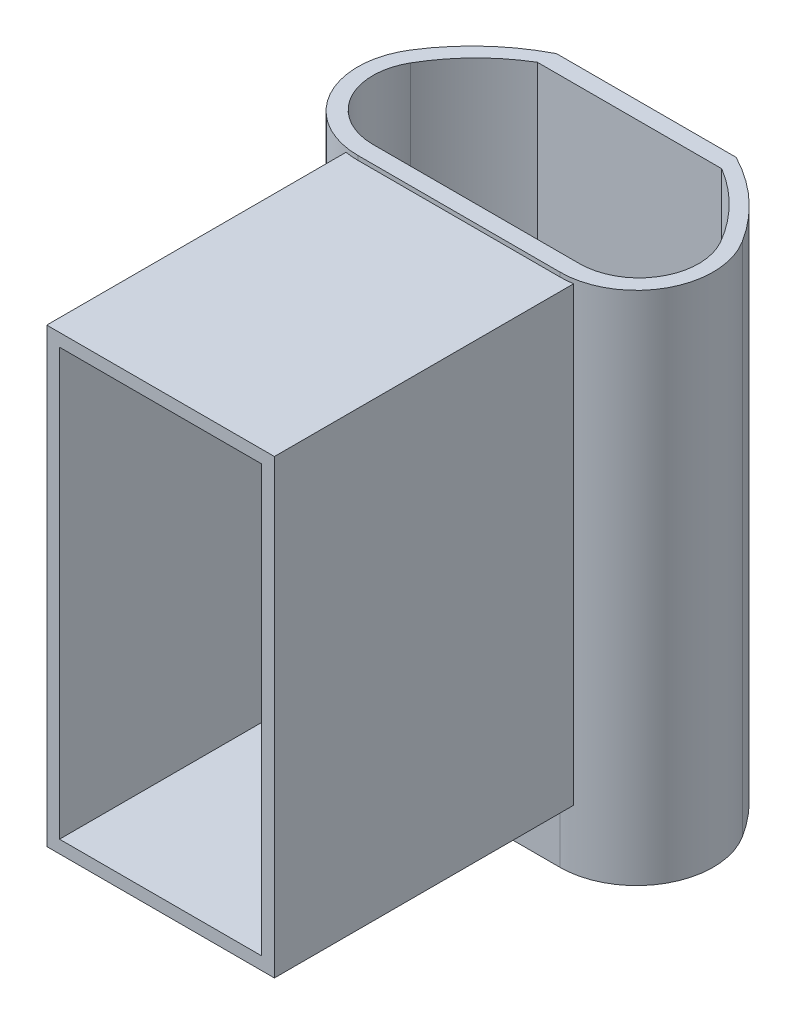
from build123d import *
from build123d.topology import SkipClean

# Parameters (mm, degrees)
CUT_EXTRUDE1_DEPTH           = 5
CUT_EXTRUDE3_DEPTH           = 70
SKETCH8_R                    = 43
CUT_EXTRUDE4_DEPTH           = 65
FILLET1_R                    = 7
SKETCH12_W                   = 6.5
SKETCH12_H                   = 63.5
CUT_REVOLVE1_ANGLE           = 60
CUT_REVOLVE1_OTHER_WAY_ANGLE = 60
SKETCH18_W                   = 13
SKETCH18_H                   = 8
CUT_EXTRUDE13_DEPTH          = 5
SKETCH20_W                   = 100
SKETCH20_H                   = 7
CUT_EXTRUDE15_DEPTH          = 5
SKETCH19_R                   = 1.5
CUT_EXTRUDE14_DEPTH          = 12
FILLET3_R                    = 4
SKETCH24_W                   = 2
SKETCH24_H                   = 3
BOSS_EXTRUDE3_DEPTH          = 2
CIRPATTERN2_COUNT            = 5
SKETCH26_W                   = 5
SKETCH26_H                   = 63.5
CUT_REVOLVE2_ANGLE           = 50
CUT_REVOLVE2_OTHER_WAY_ANGLE = 50
FILLET8_R                    = 9
SKETCH50_W                   = 13
SKETCH50_H                   = 5
CUT_EXTRUDE23_DEPTH          = 7
WRAP1_SECTION_W              = 14
WRAP1_SECTION_H              = 8
WRAP1_ANGLE                  = 29.893450181
SKETCH52_W                   = 21.079035893
SKETCH52_H                   = 8
BOSS_EXTRUDE11_DEPTH         = 7
BOSS_EXTRUDE12_START         = -1
SKETCH53_W                   = 3
SKETCH53_H                   = 7
BOSS_EXTRUDE12_DEPTH         = 3
SKETCH54_W                   = 1.6
SKETCH54_H                   = 7
BOSS_EXTRUDE13_DEPTH         = 16
SKETCH55_W                   = 4
SKETCH55_H                   = 7
BOSS_EXTRUDE14_DEPTH         = 6
SKETCH56_W                   = 3
SKETCH56_H                   = 7
CUT_EXTRUDE24_DEPTH          = 1
FILLET9_R                    = 2
SKETCH57_R                   = 1
CUT_EXTRUDE25_DEPTH          = 2
MIRROR6_START                = 14.3
MIRROR6_DEPTH                = 3.544129525
MIRROR6_START_2              = 19.844129625
MIRROR6_2_DEPTH              = 1.455870375
MIRROR6_START_3              = 17.844129525
MIRROR6_3_DEPTH              = 2.0000001
MIRROR6_START_4              = -10.618295229
MIRROR6_4_OUTLINE_R          = 1
MIRROR6_4_DEPTH              = 2
SKETCH61_W                   = 1.5
SKETCH61_H                   = 40.3
BOSS_EXTRUDE15_DEPTH         = 10
SKETCH63_W                   = 6.5
SKETCH63_H                   = 40.3
CUT_EXTRUDE27_DEPTH          = 10
CUT_EXTRUDE28_DEPTH          = 44
SKETCH67_W                   = 15
SKETCH67_H                   = 8
CUT_EXTRUDE29_DEPTH          = 5
SKETCH68_W                   = 23.715050839
SKETCH68_H                   = 50
CUT_EXTRUDE30_DEPTH          = 8
BOSS_EXTRUDE19_DEPTH         = 35
BOSS_EXTRUDE19_DEPTH_BACK    = 1
SKETCH69_W                   = 26.715050839
SKETCH69_H                   = 53
SKETCH69_W_2                 = 23.715050839
SKETCH69_H_2                 = 50
INTERSECT1_START             = 76
INTERSECT1_OUTLINE_R         = 45
INTERSECT1_OUTLINE_W         = 13
INTERSECT1_OUTLINE_H         = 8
INTERSECT1_DEPTH             = 10.5
INTERSECT1_2_OUTLINE_R       = 45
INTERSECT1_2_OUTLINE_W       = 13
INTERSECT1_2_OUTLINE_H       = 5
INTERSECT1_2_OUTLINE_W_2     = 15
INTERSECT1_2_OUTLINE_H_2     = 8
INTERSECT1_2_DEPTH           = 15.5
INTERSECT1_START_2           = 15.5
INTERSECT1_3_DEPTH           = 60.5
SKETCH70_W                   = 21.079035893
SKETCH70_H                   = 7
CUT_EXTRUDE31_DEPTH          = 10


with BuildPart() as part:
    # Sketch1 → Revolve1 (revolve)
    with BuildSketch(Plane.XY, mode=Mode.PRIVATE) as revolve1_sk:
        with BuildLine():
            Line((0, 86.5), (0, 11.5))
            Line((0, 11.5), (22.7, 11.5))
            Line((22.7, 11.5), (22.7, 0))
            Line((22.7, 0), (25, 0))
            Line((25, 0), (25, 11.5))
            Line((25, 11.5), (45, 11.5))
            Line((45, 11.5), (45, 81.5))
            ThreePointArc((45, 81.5), (43.535533906, 85.035533906), (40, 86.5))
            Line((40, 86.5), (0, 86.5))
        make_face()
    revolve(revolve1_sk.sketch.rotate(Axis((0, 2, 0), (0, 1, 0)), 90), axis=Axis((0, 2, 0), (0, 1, 0)))

    # Sketch5 → Cut-Extrude1 (cut)
    with BuildSketch(Plane(origin=(0, 86.5, 0), x_dir=(1, 0, 0), z_dir=(0, 1, 0))):
        with BuildLine():
            Line((-45, 0), (45, 0))
            ThreePointArc((45, 0), (0, 45), (-45, 0))
        make_face()
    extrude(amount=-CUT_EXTRUDE1_DEPTH, mode=Mode.SUBTRACT)

    # Sketch7 → Cut-Extrude3 (cut)
    with BuildSketch(Plane.XZ.offset(-11.5)):
        with BuildLine():
            Line((21, 0), (-21, 0))
            ThreePointArc((-21, 0), (-18.277714988, -10.340461055), (-10.816653826, -18))
            Line((-10.816653826, -18), (10.816653826, -18))
            ThreePointArc((10.816653826, -18), (18.277714988, -10.340461055), (21, 0))
        make_face()
    extrude(amount=-CUT_EXTRUDE3_DEPTH, mode=Mode.SUBTRACT)

    # Sketch8 → Cut-Extrude4 (cut)
    with BuildSketch(Plane(origin=(0, 79, 0), x_dir=(1, 0, 0), z_dir=(0, 1, 0))):
        with Locations(Location((0, 0, 0), (0, 0, 270))):
            Circle(SKETCH8_R)
        with BuildLine():
            Line((22.912878475, -2), (-22.981606036, -2))
            ThreePointArc((-22.981606036, -2), (-20.067855169, 10.855581536), (-10.573881727, 20))
            Line((-10.573881727, 20), (10.505154166, 20))
            ThreePointArc((10.505154166, 20), (19.999127608, 10.855581536), (22.912878475, -2))
        make_face(mode=Mode.SUBTRACT)
    extrude(amount=-CUT_EXTRUDE4_DEPTH, mode=Mode.SUBTRACT)

    # Fillet1
    fillet1_edges = [part.edges().sort_by_distance(p)[0] for p in [
        (-21, 46.5, 0),
        (21, 46.5, 0),
    ]]
    fillet(fillet1_edges, radius=FILLET1_R)

    # Sketch12 → Cut-Revolve1 (revolve, cut)
    with BuildSketch(Plane(origin=(0, 0, 0), x_dir=(0, 0, -1), z_dir=(1, 0, 0))):
        with Locations((-44.75, 47.25)):
            Rectangle(SKETCH12_W, SKETCH12_H)
    revolve(axis=Axis((0, 81.5, 0), (0, -1, 0)), revolution_arc=CUT_REVOLVE1_ANGLE, mode=Mode.SUBTRACT)

    # Sketch12 → Cut-Revolve1 other way (revolve, cut)
    with BuildSketch(Plane(origin=(0, 0, 0), x_dir=(0, 0, -1), z_dir=(1, 0, 0))):
        with Locations((-44.75, 47.25)):
            Rectangle(SKETCH12_W, SKETCH12_H)
    revolve(axis=Axis((0, 81.5, 0), (0, 1, 0)), revolution_arc=CUT_REVOLVE1_OTHER_WAY_ANGLE, mode=Mode.SUBTRACT)

    # Sketch18 → Cut-Extrude13 (cut)
    with BuildSketch(Plane(origin=(0, 81.5, 0), x_dir=(1, 0, 0), z_dir=(0, 1, 0))):
        with Locations((0, 30)):
            Rectangle(SKETCH18_W, SKETCH18_H)
    extrude(amount=-CUT_EXTRUDE13_DEPTH, mode=Mode.SUBTRACT)

    # Sketch20 → Cut-Extrude15 (cut)
    with BuildSketch(Plane(origin=(0, 86.5, 0), x_dir=(1, 0, 0), z_dir=(0, 1, 0))):
        with Locations((0, -3.5)):
            Rectangle(SKETCH20_W, SKETCH20_H)
    extrude(amount=-CUT_EXTRUDE15_DEPTH, mode=Mode.SUBTRACT)

    # Sketch19 → Cut-Extrude14 (cut)
    with BuildSketch(Plane(origin=(0, 0, 7), x_dir=(-1, 0, 0), z_dir=(0, 0, -1))):
        with Locations((0, 84)):
            Circle(SKETCH19_R)
        with Locations((-30, 84)):
            Circle(SKETCH19_R)
        with Locations((29.452221542, 84)):
            Circle(SKETCH19_R)
    extrude(amount=-CUT_EXTRUDE14_DEPTH, mode=Mode.SUBTRACT)

    # Fillet3
    fillet3_edges = [part.edges().sort_by_distance(p)[0] for p in [
        (0, 11.5, 45),
    ]]
    fillet(fillet3_edges, radius=FILLET3_R - 0.0001)  # a hair under: the kernel refuses the full size

    # Sketch24 → Boss-Extrude3 (add)
    with BuildSketch(Plane.XZ):
        with Locations((0, -22.7)):
            Rectangle(SKETCH24_W, SKETCH24_H)
    boss_extrude3 = extrude(amount=-BOSS_EXTRUDE3_DEPTH)

    # CirPattern2: Boss-Extrude3 ×5 about axis
    cirpattern2_axis = Axis((0, 0, 0), (0, 1, 0))
    for i in range(1, CIRPATTERN2_COUNT):
        add(boss_extrude3.rotate(cirpattern2_axis, i * 360 / CIRPATTERN2_COUNT))

    # Sketch26 → Cut-Revolve2 (revolve, cut)
    with BuildSketch(Plane(origin=(0, 0, 0), x_dir=(0, 0, -1), z_dir=(1, 0, 0))):
        with Locations((45.056943441, 47.25)):
            Rectangle(SKETCH26_W, SKETCH26_H)
    revolve(axis=Axis((0, 2, 0), (0, -1, 0)), revolution_arc=CUT_REVOLVE2_ANGLE, mode=Mode.SUBTRACT)

    # Sketch26 → Cut-Revolve2 other way (revolve, cut)
    with BuildSketch(Plane(origin=(0, 0, 0), x_dir=(0, 0, -1), z_dir=(1, 0, 0))):
        with Locations((45.056943441, 47.25)):
            Rectangle(SKETCH26_W, SKETCH26_H)
    revolve(axis=Axis((0, 2, 0), (0, 1, 0)), revolution_arc=CUT_REVOLVE2_OTHER_WAY_ANGLE, mode=Mode.SUBTRACT)

    # Fillet8
    fillet8_edges = [part.edges().sort_by_distance(p)[0] for p in [
        (-22.981606036, 46.5, 2),
        (22.912878475, 46.5, 2),
    ]]
    fillet(fillet8_edges, radius=FILLET8_R)

    # Sketch50 → Cut-Extrude23 (cut)
    with BuildSketch(Plane(origin=(0, 14, 0), x_dir=(1, 0, 0), z_dir=(0, 1, 0))):
        with Locations((32, 0)):
            Rectangle(SKETCH50_W, SKETCH50_H)
        with Locations((-32, 0)):
            Rectangle(SKETCH50_W, SKETCH50_H)
    extrude(amount=-CUT_EXTRUDE23_DEPTH, mode=Mode.SUBTRACT)

    # Wrap1 section (on wrap section) → Wrap1 (revolve)
    with BuildSketch(Plane(origin=(-0.03436378, 79, 0.443056559), x_dir=(0.8417807911855657, 0, -0.5398195064936087), z_dir=(0.5398195064936087, 0, 0.8417807911855657))):
        with Locations((30, -61)):
            Rectangle(WRAP1_SECTION_W, WRAP1_SECTION_H)
    wrap1 = revolve(axis=Axis((-0.03436378, 79, 0.443056559), (0, 1, 0)), revolution_arc=WRAP1_ANGLE)

    # Mirror3: Wrap1 across plane
    add(wrap1.mirror(Plane(origin=(0, 0, 0), x_dir=(0, 0, 1), z_dir=(1, 0, 0))))

    # Sketch52 → Boss-Extrude11 (add)
    with BuildSketch(Plane(origin=(0, 0, -20), x_dir=(-1, 0, 0), z_dir=(0, 0, -1))):
        with Locations((0.03436378, 18)):
            Rectangle(SKETCH52_W, SKETCH52_H)
    extrude(amount=BOSS_EXTRUDE11_DEPTH)



with BuildPart() as body_2:
    # Sketch53 → Boss-Extrude12 (new body)
    with BuildSketch(Plane(origin=(20.823161639, 0, 0), x_dir=(0, 0, -1), z_dir=(1, 0, 0)).offset(BOSS_EXTRUDE12_START)):
        with Locations((9.818295229, 17.8)):
            Rectangle(SKETCH53_W, SKETCH53_H)
    extrude(amount=BOSS_EXTRUDE12_DEPTH)


with BuildPart() as part_1:
    add(part.part)

    add(body_2.part)  # Boss-Extrude13 merges body 2
    # Sketch54 → Boss-Extrude13 (add)
    with BuildSketch(Plane(origin=(22.823161639, 0, 0), x_dir=(0, 0, -1), z_dir=(1, 0, 0))):
        with Locations((9.818295229, 17.8)):
            Rectangle(SKETCH54_W, SKETCH54_H)
    extrude(amount=BOSS_EXTRUDE13_DEPTH)

    # Sketch55 → Boss-Extrude14 (add)
    with BuildSketch(Plane.XY.offset(-9.118295229)):
        with Locations((34.823161639, 17.8)):
            Rectangle(SKETCH55_W, SKETCH55_H)
    extrude(amount=BOSS_EXTRUDE14_DEPTH)

    # Sketch56 → Cut-Extrude24 (cut)
    with BuildSketch(Plane.XY.offset(-9.018295229)):
        with Locations((25.823161639, 17.8)):
            Rectangle(SKETCH56_W, SKETCH56_H)
    extrude(amount=-CUT_EXTRUDE24_DEPTH, mode=Mode.SUBTRACT)

    # Fillet9
    # the kernel refuses this fillet: 2 mm, written as the material it takes off along each edge
    with BuildSketch(Plane(origin=(27.323161639, 25.630127019, -9.018295229), x_dir=(0, 0, -1), z_dir=(0, -1, 0))) as fillet9_piece_1_section:
        with BuildLine():
            CenterArc((2, 1.732050808), FILLET9_R, 180, 60)
            Line((0, 1.732050808), (0, 0))
            Line((0, 0), (1, 0))
        make_face()
    fillet9_piece_1 = extrude(amount=15.660254038, mode=Mode.PRIVATE)
    fillet9_piece_1 = split(fillet9_piece_1, bisect_by=Plane(origin=(27.323161639, 14, -9.018295229), z_dir=(0, 1, 0)), keep=Keep.TOP, mode=Mode.PRIVATE)
    add(fillet9_piece_1, mode=Mode.SUBTRACT)

    # Sketch57 → Cut-Extrude25 (cut)
    with BuildSketch(Plane(origin=(0, 0, -10.618295229), x_dir=(-1, 0, 0), z_dir=(0, 0, -1))):
        with Locations(Location((-36.823161639, 18.844129625, 0), (0, 0, 90))):
            Circle(SKETCH57_R)
    extrude(amount=-CUT_EXTRUDE25_DEPTH, mode=Mode.SUBTRACT)

    # Mirror6: read off the stored shape, not the designer's step
    # Mirror6 outline → Mirror6 (add)
    with BuildSketch(Plane(origin=(0, 0, 0), x_dir=(1, 0, 0), z_dir=(0, 1, 0)).offset(MIRROR6_START)):
        with BuildLine():
            Line((-32.823161639, 9.018295229), (-29.055212446, 9.018295229))
            ThreePointArc((-29.055212446, 9.018295229), (-28.055212446, 9.286244421), (-27.323161639, 10.018295229))
            Line((-27.323161639, 10.018295229), (-24.323161639, 10.018295229))
            Line((-24.323161639, 10.018295229), (-24.323161639, 9.018295229))
            Line((-24.323161639, 9.018295229), (-22.823161639, 9.018295229))
            Line((-22.823161639, 9.018295229), (-22.823161639, 8.318295229))
            Line((-22.823161639, 8.318295229), (-20.794815555, 8.318295229))
            ThreePointArc((-20.794815555, 8.318295229), (-20.436002794, 9.828095276), (-19.823161639, 11.253812113))
            Line((-19.823161639, 11.253812113), (-19.823161639, 11.318295229))
            Line((-19.823161639, 11.318295229), (-22.823161639, 11.318295229))
            Line((-22.823161639, 11.318295229), (-22.823161639, 10.618295229))
            Line((-22.823161639, 10.618295229), (-38.823161639, 10.618295229))
            Line((-38.823161639, 10.618295229), (-38.823161639, 9.018295229))
            Line((-38.823161639, 9.018295229), (-36.823161639, 9.018295229))
            Line((-36.823161639, 9.018295229), (-36.823161639, 8.618295229))
            Line((-36.823161639, 8.618295229), (-36.823161639, 3.118295229))
            Line((-36.823161639, 3.118295229), (-32.823161639, 3.118295229))
            Line((-32.823161639, 3.118295229), (-32.823161639, 9.018295229))
        make_face()
    extrude(amount=MIRROR6_DEPTH)

    # Mirror6 2 outline → Mirror6 2 (add)
    with BuildSketch(Plane(origin=(0, 0, 0), x_dir=(1, 0, 0), z_dir=(0, 1, 0)).offset(MIRROR6_START_2)):
        with BuildLine():
            Line((-32.823161639, 9.018295229), (-29.055212446, 9.018295229))
            ThreePointArc((-29.055212446, 9.018295229), (-28.055212446, 9.286244421), (-27.323161639, 10.018295229))
            Line((-27.323161639, 10.018295229), (-24.323161639, 10.018295229))
            Line((-24.323161639, 10.018295229), (-24.323161639, 9.018295229))
            Line((-24.323161639, 9.018295229), (-22.823161639, 9.018295229))
            Line((-22.823161639, 9.018295229), (-22.823161639, 8.318295229))
            Line((-22.823161639, 8.318295229), (-20.794815555, 8.318295229))
            ThreePointArc((-20.794815555, 8.318295229), (-20.436002794, 9.828095276), (-19.823161639, 11.253812113))
            Line((-19.823161639, 11.253812113), (-19.823161639, 11.318295229))
            Line((-19.823161639, 11.318295229), (-22.823161639, 11.318295229))
            Line((-22.823161639, 11.318295229), (-22.823161639, 10.618295229))
            Line((-22.823161639, 10.618295229), (-38.823161639, 10.618295229))
            Line((-38.823161639, 10.618295229), (-38.823161639, 9.018295229))
            Line((-38.823161639, 9.018295229), (-36.823161639, 9.018295229))
            Line((-36.823161639, 9.018295229), (-36.823161639, 8.618295229))
            Line((-36.823161639, 8.618295229), (-36.823161639, 3.118295229))
            Line((-36.823161639, 3.118295229), (-32.823161639, 3.118295229))
            Line((-32.823161639, 3.118295229), (-32.823161639, 9.018295229))
        make_face()
    extrude(amount=MIRROR6_2_DEPTH)

    # Mirror6 3 outline → Mirror6 3 (add)
    with BuildSketch(Plane(origin=(0, 0, 0), x_dir=(1, 0, 0), z_dir=(0, 1, 0)).offset(MIRROR6_START_3)):
        with BuildLine():
            Line((-32.823161639, 9.018295229), (-29.055212446, 9.018295229))
            ThreePointArc((-29.055212446, 9.018295229), (-28.055212446, 9.286244421), (-27.323161639, 10.018295229))
            Line((-27.323161639, 10.018295229), (-24.323161639, 10.018295229))
            Line((-24.323161639, 10.018295229), (-24.323161639, 9.018295229))
            Line((-24.323161639, 9.018295229), (-22.823161639, 9.018295229))
            Line((-22.823161639, 9.018295229), (-22.823161639, 8.318295229))
            Line((-22.823161639, 8.318295229), (-20.794815555, 8.318295229))
            ThreePointArc((-20.794815555, 8.318295229), (-20.436002794, 9.828095276), (-19.823161639, 11.253812113))
            Line((-19.823161639, 11.253812113), (-19.823161639, 11.318295229))
            Line((-19.823161639, 11.318295229), (-22.823161639, 11.318295229))
            Line((-22.823161639, 11.318295229), (-22.823161639, 10.618295229))
            Line((-22.823161639, 10.618295229), (-38.823161639, 10.618295229))
            Line((-38.823161639, 10.618295229), (-38.823161639, 9.018295229))
            Line((-38.823161639, 9.018295229), (-36.823161639, 9.018295229))
            Line((-36.823161639, 9.018295229), (-36.823161639, 8.618295229))
            Line((-36.823161639, 8.618295229), (-36.823161639, 3.118295229))
            Line((-36.823161639, 3.118295229), (-32.823161639, 3.118295229))
            Line((-32.823161639, 3.118295229), (-32.823161639, 9.018295229))
        make_face()
    extrude(amount=MIRROR6_3_DEPTH)

    # Mirror6 4 outline → Mirror6 4 (cut)
    with BuildSketch(Plane.XY.offset(MIRROR6_START_4)):
        with Locations((-36.823161639, 18.844129625)):
            Circle(MIRROR6_4_OUTLINE_R)
    extrude(amount=MIRROR6_4_DEPTH, mode=Mode.SUBTRACT)

    # Sketch61 → Boss-Extrude15 (add)
    with BuildSketch(Plane(origin=(45, 0, 0), x_dir=(0, 0, -1), z_dir=(1, 0, 0))):
        with Locations((23.675442436, 50.15)):
            Rectangle(SKETCH61_W, SKETCH61_H)
        with Locations((15.675442436, 50.15)):
            Rectangle(SKETCH61_W, SKETCH61_H)
        Polygon((24.425442436, 30), (24.425442436, 28.5), (14.925442436, 28.5), (14.925442436, 30), (16.425442436, 30), (22.925442436, 30), align=None)
        Polygon((22.925442436, 70.3), (24.425442436, 70.3), (24.425442436, 71.8), (14.925442436, 71.8), (14.925442436, 70.3), (16.425442436, 70.3), align=None)
    extrude(amount=-BOSS_EXTRUDE15_DEPTH)

    # Sketch63 → Cut-Extrude27 (cut)
    with BuildSketch(Plane(origin=(45, 0, 0), x_dir=(0, 0, -1), z_dir=(1, 0, 0))):
        with Locations((19.675442436, 50.15)):
            Rectangle(SKETCH63_W, SKETCH63_H)
    extrude(amount=-CUT_EXTRUDE27_DEPTH, mode=Mode.SUBTRACT)

    # Sketch66 → Cut-Extrude28 (cut)
    with SkipClean():  # the faces are left unmerged after this step: merging them gives an invalid solid
        with BuildSketch(Plane(origin=(0, 71.8, 0), x_dir=(1, 0, 0), z_dir=(0, 1, 0))):
            with BuildLine():
                Line((42.452693296, 14.925442436), (45, 14.925442436))
                Line((45, 14.925442436), (45, 24.425442436))
                Line((45, 24.425442436), (37.794149836, 24.425442436))
                ThreePointArc((37.794149836, 24.425442436), (40.403606994, 19.812837804), (42.452693296, 14.925442436))
            make_face()
        extrude(amount=-CUT_EXTRUDE28_DEPTH, mode=Mode.SUBTRACT)

    # Sketch67 → Cut-Extrude29 (cut)
    with SkipClean():  # the faces are left unmerged after this step: merging them gives an invalid solid
        with BuildSketch(Plane.XZ.offset(-11.5)):
            with Locations((0, 35.077013509)):
                Rectangle(SKETCH67_W, SKETCH67_H)
        extrude(amount=-CUT_EXTRUDE29_DEPTH, mode=Mode.SUBTRACT)

    # Sketch68 → Cut-Extrude30 (cut)
    with SkipClean():  # the faces are left unmerged after this step: merging them gives an invalid solid
        with BuildSketch(Plane.XY.offset(2)):
            with Locations((-0.034363781, 49)):
                Rectangle(SKETCH68_W, SKETCH68_H)
        extrude(amount=-CUT_EXTRUDE30_DEPTH, mode=Mode.SUBTRACT)

    # Sketch69 → Boss-Extrude19 (add, two sides: drawn at the far end of the back side and taken through both)
    with SkipClean():  # the faces are left unmerged after this step: merging them gives an invalid solid
        with BuildSketch(Plane.XY.offset(2).offset(-BOSS_EXTRUDE19_DEPTH_BACK)):
            with Locations((-0.034363781, 49)):
                Rectangle(SKETCH69_W, SKETCH69_H)
            with Locations((-0.034363781, 49)):
                Rectangle(SKETCH69_W_2, SKETCH69_H_2, mode=Mode.SUBTRACT)
        extrude(amount=BOSS_EXTRUDE19_DEPTH + BOSS_EXTRUDE19_DEPTH_BACK)

    # Intersect1: read off the stored shape, not the designer's step
    # Intersect1 outline → Intersect1 (cut)
    with SkipClean():  # the faces are left unmerged after this step: merging them gives an invalid solid
        with BuildSketch(Plane(origin=(0, 0, 0), x_dir=(1, 0, 0), z_dir=(0, 1, 0)).offset(INTERSECT1_START)):
            Circle(INTERSECT1_OUTLINE_R)
            with Locations((0, 30)):
                Rectangle(INTERSECT1_OUTLINE_W, INTERSECT1_OUTLINE_H, mode=Mode.SUBTRACT)
        extrude(amount=INTERSECT1_DEPTH, mode=Mode.SUBTRACT)

    # Intersect1 2 outline → Intersect1 2 (cut)
    with SkipClean():  # the faces are left unmerged after this step: merging them gives an invalid solid
        with BuildSketch(Plane(origin=(0, 0, 0), x_dir=(1, 0, 0), z_dir=(0, 1, 0))):
            Circle(INTERSECT1_2_OUTLINE_R)
            with Locations((-32, 0)):
                Rectangle(INTERSECT1_2_OUTLINE_W, INTERSECT1_2_OUTLINE_H, mode=Mode.SUBTRACT)
            with Locations((32, 0)):
                Rectangle(INTERSECT1_2_OUTLINE_W, INTERSECT1_2_OUTLINE_H, mode=Mode.SUBTRACT)
            with Locations((0, -35.077013509)):
                Rectangle(INTERSECT1_2_OUTLINE_W_2, INTERSECT1_2_OUTLINE_H_2, mode=Mode.SUBTRACT)
        extrude(amount=INTERSECT1_2_DEPTH, mode=Mode.SUBTRACT)

    # Intersect1 3 outline → Intersect1 3 (cut)
    with BuildSketch(Plane(origin=(0, 0, 0), x_dir=(1, 0, 0), z_dir=(0, 1, 0)).offset(INTERSECT1_START_2)):
        with BuildLine():
            ThreePointArc((40.326556611, 14.925442436), (42.846361448, -3.631709055), (37.239092363, -21.5))
            Line((37.239092363, -21.5), (38.97114317, -22.5))
            ThreePointArc((38.97114317, -22.5), (44.828761414, 3.922008424), (34.47199994, 28.925442436))
            Line((34.47199994, 28.925442436), (32.939911054, 27.639867217))
            ThreePointArc((32.939911054, 27.639867217), (34.202355022, 26.061444913), (35.389232286, 24.425442436))
            Line((35.389232286, 24.425442436), (35, 24.425442436))
            Line((35, 24.425442436), (35, 14.925442436))
            Line((35, 14.925442436), (40.326556611, 14.925442436))
        make_face()
        with BuildLine():
            Line((-38.97114317, -22.5), (-37.239092363, -21.5))
            ThreePointArc((-37.239092363, -21.5), (-42.836372018, 3.747696938), (-32.939911054, 27.639867217))
            Line((-32.939911054, 27.639867217), (-34.47199994, 28.925442436))
            ThreePointArc((-34.47199994, 28.925442436), (-44.828761414, 3.922008424), (-38.97114317, -22.5))
        make_face()
    extrude(amount=INTERSECT1_3_DEPTH, mode=Mode.SUBTRACT)

    # Sketch70 → Cut-Extrude31 (cut)
    with BuildSketch(Plane(origin=(0, 22, 0), x_dir=(1, 0, 0), z_dir=(0, 1, 0))):
        with BuildLine():
            Line((24.323161639, 10.018295229), (27.323161639, 10.018295229))
            ThreePointArc((27.323161639, 10.018295229), (28.055212446, 9.286244421), (29.055212446, 9.018295229))
            Line((29.055212446, 9.018295229), (32.823161639, 9.018295229))
            Line((32.823161639, 9.018295229), (32.823161639, 3.118295229))
            Line((32.823161639, 3.118295229), (36.823161639, 3.118295229))
            Line((36.823161639, 3.118295229), (36.823161639, 9.018295229))
            Line((36.823161639, 9.018295229), (38.823161639, 9.018295229))
            Line((38.823161639, 9.018295229), (38.823161639, 10.618295229))
            Line((38.823161639, 10.618295229), (22.823161639, 10.618295229))
            Line((22.823161639, 10.618295229), (22.823161639, 11.318295229))
            Line((22.823161639, 11.318295229), (19.823161639, 11.318295229))
            Line((19.823161639, 11.318295229), (19.823161639, 11.123105626))
            ThreePointArc((19.823161639, 11.123105626), (20.390189722, 9.757903156), (20.726087994, 8.318295229))
            Line((20.726087994, 8.318295229), (22.823161639, 8.318295229))
            Line((22.823161639, 8.318295229), (22.823161639, 9.018295229))
            Line((22.823161639, 9.018295229), (24.323161639, 9.018295229))
            Line((24.323161639, 9.018295229), (24.323161639, 10.018295229))
        make_face()
        with BuildLine():
            Line((-22.823161639, 8.318295229), (-20.794815555, 8.318295229))
            ThreePointArc((-20.794815555, 8.318295229), (-20.436002794, 9.828095276), (-19.823161639, 11.253812113))
            Line((-19.823161639, 11.253812113), (-19.823161639, 11.318295229))
            Line((-19.823161639, 11.318295229), (-22.823161639, 11.318295229))
            Line((-22.823161639, 11.318295229), (-22.823161639, 10.618295229))
            Line((-22.823161639, 10.618295229), (-38.823161639, 10.618295229))
            Line((-38.823161639, 10.618295229), (-38.823161639, 9.018295229))
            Line((-38.823161639, 9.018295229), (-36.823161639, 9.018295229))
            Line((-36.823161639, 9.018295229), (-36.823161639, 3.118295229))
            Line((-36.823161639, 3.118295229), (-32.823161639, 3.118295229))
            Line((-32.823161639, 3.118295229), (-32.823161639, 9.018295229))
            Line((-32.823161639, 9.018295229), (-29.055212446, 9.018295229))
            ThreePointArc((-29.055212446, 9.018295229), (-28.055212446, 9.286244421), (-27.323161639, 10.018295229))
            Line((-27.323161639, 10.018295229), (-24.323161639, 10.018295229))
            Line((-24.323161639, 10.018295229), (-24.323161639, 9.018295229))
            Line((-24.323161639, 9.018295229), (-22.823161639, 9.018295229))
            Line((-22.823161639, 9.018295229), (-22.823161639, 8.318295229))
        make_face()
        with BuildLine():
            Line((-31.111525493, 19.530265182), (-19.375269228, 12.004006408))
            ThreePointArc((-19.375269228, 12.004006408), (-15.501692684, 16.579332716), (-10.577325869, 19.998223989))
            Line((-10.577325869, 19.998223989), (-17.013204462, 32.395646477))
            ThreePointArc((-17.013204462, 32.395646477), (-24.906202488, 26.887661584), (-31.111525493, 19.530265182))
        make_face()
        with BuildLine():
            Line((17.013204462, 32.395646477), (10.562773235, 19.970191274))
            ThreePointArc((10.562773235, 19.970191274), (15.469231468, 16.546308773), (19.326594417, 11.972792091))
            Line((19.326594417, 11.972792091), (31.111525493, 19.530265182))
            ThreePointArc((31.111525493, 19.530265182), (24.906202488, 26.887661584), (17.013204462, 32.395646477))
        make_face()
        with Locations((-0.03436378, 23.5)):
            Rectangle(SKETCH70_W, SKETCH70_H)
    extrude(amount=-CUT_EXTRUDE31_DEPTH, mode=Mode.SUBTRACT)


solid = part_1.part
